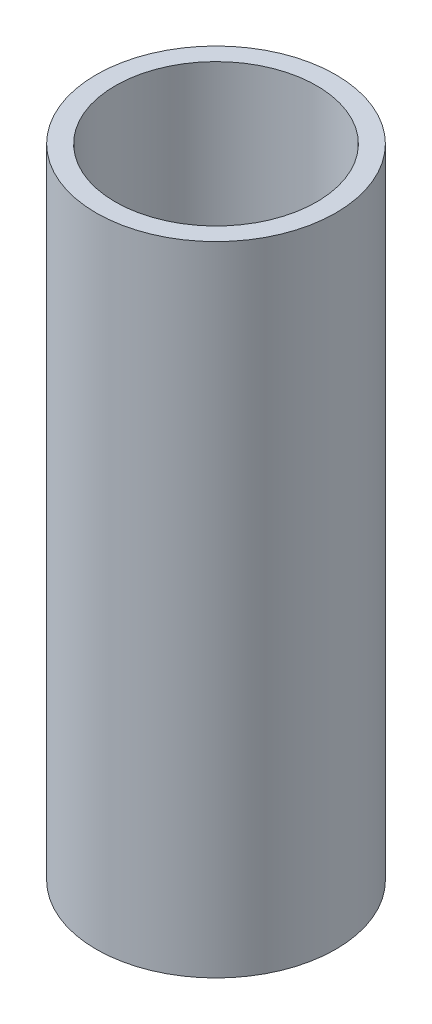
from build123d import *

# Parameters (mm, degrees)
SKETCH1_R           = 25
BOSS_EXTRUDE1_DEPTH = 133.091454908
SKETCH2_R           = 21.017134978
CUT_EXTRUDE1_DEPTH  = 138.707426705


with BuildPart() as part:
    # Sketch1 → Boss-Extrude1 (new body)
    with BuildSketch(Plane(origin=(0, 0, 0), x_dir=(1, 0, 0), z_dir=(0, 1, 0))):
        Circle(SKETCH1_R)
    extrude(amount=BOSS_EXTRUDE1_DEPTH)

    # Sketch2 → Cut-Extrude1 (cut, through all)
    with BuildSketch(Plane(origin=(0, 0, 0), x_dir=(1, 0, 0), z_dir=(0, 1, 0))):
        Circle(SKETCH2_R)
    extrude(amount=CUT_EXTRUDE1_DEPTH, mode=Mode.SUBTRACT)


solid = part.part
